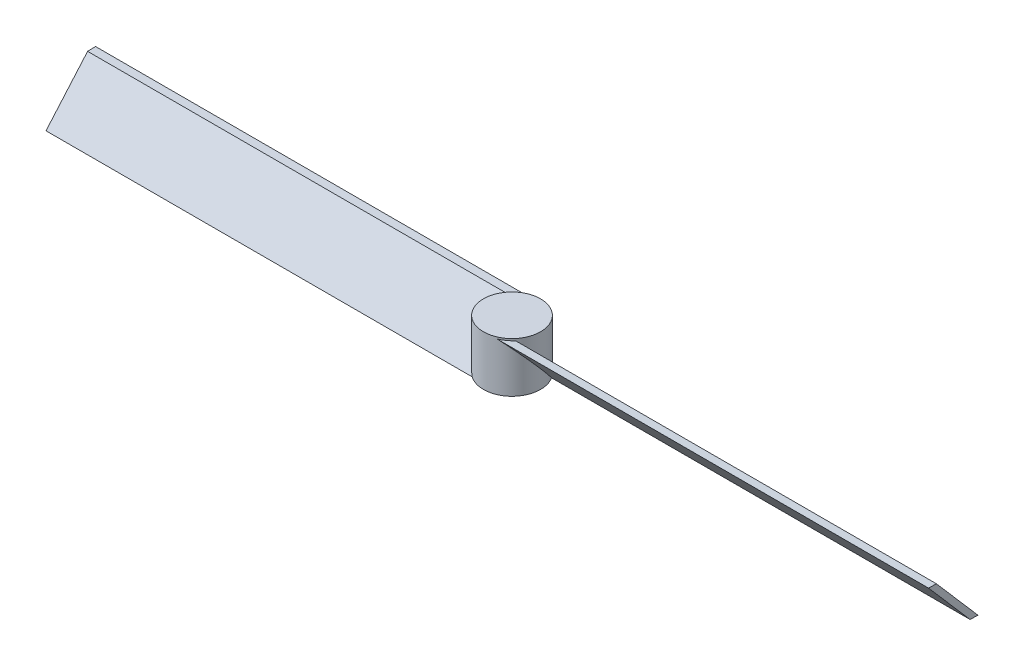
from build123d import *
from build123d.topology import SkipClean

# Parameters (mm, degrees)
SKETCH1_R           = 2
BOSS_EXTRUDE1_DEPTH = 3.5
SKETCH2_R           = 0.42
CUT_EXTRUDE1_DEPTH  = 2.5
BOSS_EXTRUDE2_DEPTH = 31
BOSS_EXTRUDE3_DEPTH = 31


with BuildPart() as part:
    # Sketch1 → Boss-Extrude1 (new body)
    with BuildSketch(Plane(origin=(0, 0, 0), x_dir=(1, 0, 0), z_dir=(0, 1, 0))):
        Circle(SKETCH1_R)
    extrude(amount=BOSS_EXTRUDE1_DEPTH)

    # Sketch2 → Cut-Extrude1 (cut)
    with BuildSketch(Plane(origin=(0, 0, 0), x_dir=(1, 0, 0), z_dir=(0, 1, 0))):
        Circle(SKETCH2_R)
    extrude(amount=CUT_EXTRUDE1_DEPTH, mode=Mode.SUBTRACT)

    # Sketch3 → Boss-Extrude2 (add)
    with SkipClean():  # the faces are left unmerged after this step: merging them gives an invalid solid
        with BuildSketch(Plane(origin=(0, 0, 0), x_dir=(0, 0, -1), z_dir=(1, 0, 0))):
            Polygon((1.627531183, 0), (-1.283933552, 3.362939097), (-1.838612291, 3.379776249), (1.072852444, 0.016837151), align=None)
        extrude(amount=BOSS_EXTRUDE2_DEPTH)

    # Sketch4 → Boss-Extrude3 (add)
    with SkipClean():  # the faces are left unmerged after this step: merging them gives an invalid solid
        with BuildSketch(Plane.ZY):
            Polygon((1.627531183, 0), (-1.283933552, 3.362939097), (-1.838612291, 3.379776249), (1.072852444, 0.016837151), align=None)
        extrude(amount=BOSS_EXTRUDE3_DEPTH)


solid = part.part
